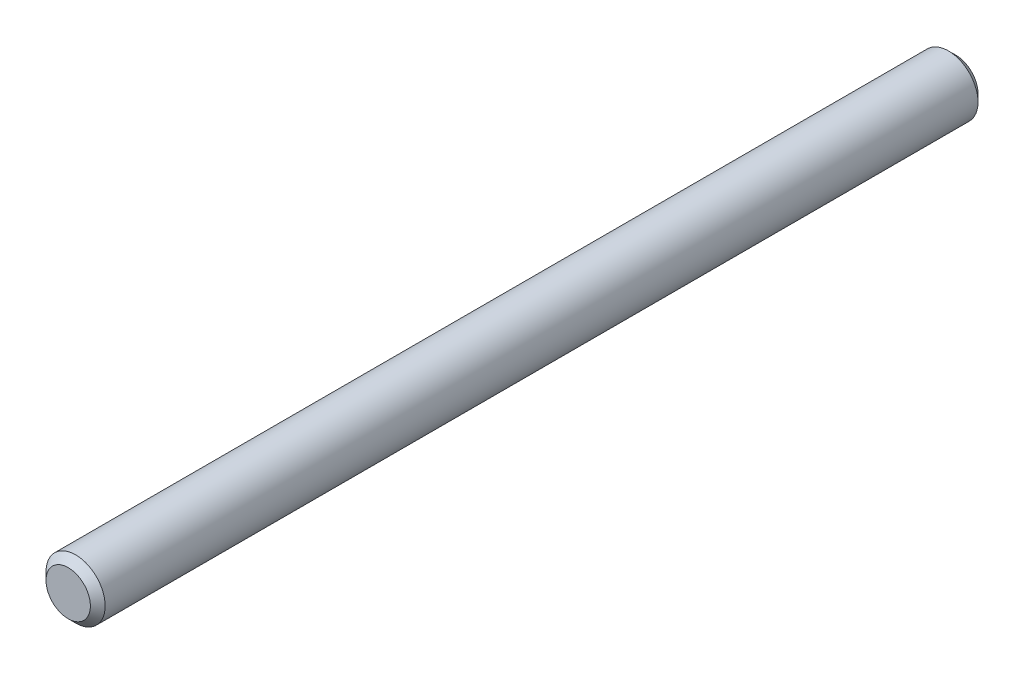
from build123d import *

# Parameters (mm, degrees)
SKETCH_1_R      = 2
EXTRUDE_1_DEPTH = 60
CHAMFER_1_SIZE  = 0.5


with BuildPart() as part:
    # 草图1 → 凸台-拉伸1 (new body)
    with BuildSketch(Plane.XY):
        Circle(SKETCH_1_R)
    extrude(amount=-EXTRUDE_1_DEPTH)

    # 倒角1
    chamfer_1_edges = [part.edges().sort_by_distance(p)[0] for p in [
        (-2, 0, -60),
        (-2, 0, 0),
    ]]
    chamfer(chamfer_1_edges, length=CHAMFER_1_SIZE)


solid = part.part
